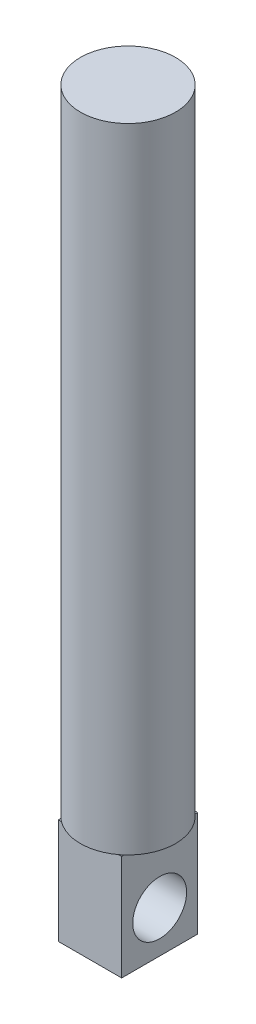
from build123d import *

# Parameters (mm, degrees)
SKETCH1_W           = 5
SKETCH1_H           = 6
BOSS_EXTRUDE1_DEPTH = 8.31
SKETCH2_R           = 2.125
CUT_EXTRUDE1_DEPTH  = 10
SKETCH3_R           = 3.75
BOSS_EXTRUDE2_DEPTH = 50


with BuildPart() as part:
    # Sketch1 → Boss-Extrude1 (new body)
    with BuildSketch(Plane(origin=(0, 0, 0), x_dir=(1, 0, 0), z_dir=(0, 1, 0))):
        with Locations((2.5, 3)):
            Rectangle(SKETCH1_W, SKETCH1_H)
    extrude(amount=BOSS_EXTRUDE1_DEPTH)

    # Sketch2 → Cut-Extrude1 (cut)
    with BuildSketch(Plane(origin=(5, 0, 0), x_dir=(0, 0, -1), z_dir=(1, 0, 0))):
        with Locations((3, 3.31)):
            Circle(SKETCH2_R)
    extrude(amount=-CUT_EXTRUDE1_DEPTH, mode=Mode.SUBTRACT)

    # Sketch3 → Boss-Extrude2 (add)
    with BuildSketch(Plane(origin=(0, 8.31, 0), x_dir=(1, 0, 0), z_dir=(0, 1, 0))):
        with Locations((2.5, 3)):
            Circle(SKETCH3_R)
    extrude(amount=BOSS_EXTRUDE2_DEPTH)


solid = part.part
